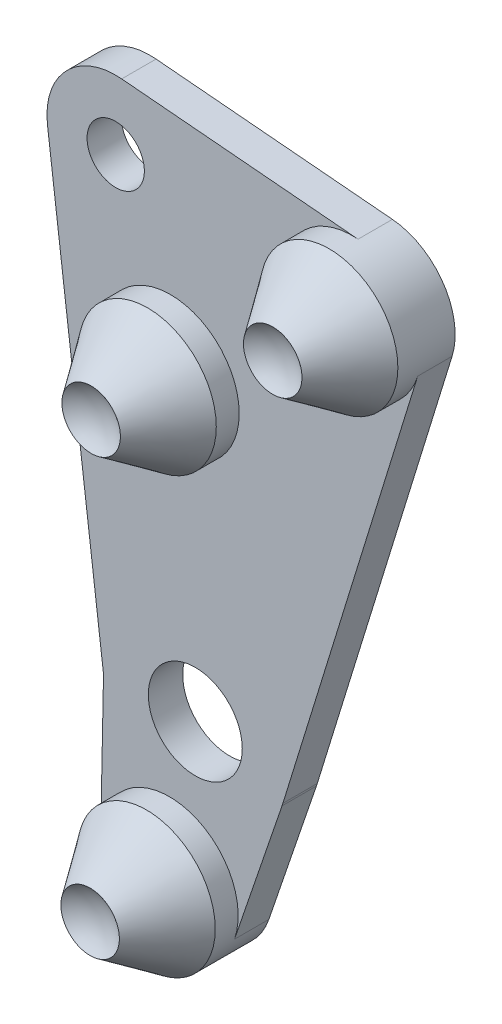
from build123d import *
from build123d.topology import SkipClean

# Parameters (mm, degrees)
BOSS_EXTRUDE1_DEPTH = 3
BOSS_EXTRUDE5_DEPTH = 3
BOSS_EXTRUDE2_DEPTH = 3
SKETCH3_R           = 4.1
CUT_EXTRUDE1_DEPTH  = 50
SKETCH1_4_R         = 6
BOSS_EXTRUDE3_DEPTH = 10
SKETCH2_4_R         = 6
BOSS_EXTRUDE4_DEPTH = 10
CHAMFER1_SIZE       = 5
CHAMFER1_SIZE_2     = 3.501037691
SKETCH9_R           = 2.5
CUT_EXTRUDE2_DEPTH  = 3


with BuildPart() as part:
    # Sketch1 → Boss-Extrude1 (new body)
    with BuildSketch(Plane.XY):
        with BuildLine():
            ThreePointArc((-7.862783113, 28.36246747), (-9.674812704, 26.016588816), (-10.142674299, 23.089524856))
            Line((-10.142674299, 23.089524856), (-7.966824047, -0.727814955))
            ThreePointArc((-7.966824047, -0.727814955), (-0.830270862, -7.956798998), (7.644946217, -2.356861757))
            Line((7.644946217, -2.356861757), (19.414515396, 35.820058514))
            ThreePointArc((19.414515396, 35.820058514), (17.084366379, 42.528936958), (9.985578884, 42.314786229))
            Line((9.985578884, 42.314786229), (-7.862783113, 28.36246747))
        make_face()
    extrude(amount=BOSS_EXTRUDE1_DEPTH)

    # Sketch8 → Boss-Extrude5 (add)
    with BuildSketch(Plane.XY):
        with BuildLine():
            Line((14.20374019, 43.56487302), (-6.42299265, 45.369478309))
            ThreePointArc((-6.42299265, 45.369478309), (-11.266837417, 43.555209842), (-12.899477398, 38.647166557))
            Line((-12.899477398, 38.647166557), (-7.938067055, -0.993524752))
            ThreePointArc((-7.938067055, -0.993524752), (-7.953555222, -0.86078995), (-7.966824047, -0.727814955))
            Line((-7.966824047, -0.727814955), (-10.142674299, 23.089524856))
            ThreePointArc((-10.142674299, 23.089524856), (-9.674812704, 26.016588816), (-7.862783113, 28.36246747))
            Line((-7.862783113, 28.36246747), (9.985578884, 42.314786229))
            ThreePointArc((9.985578884, 42.314786229), (11.97594826, 43.340396462), (14.20374019, 43.56487302))
        make_face()
    extrude(amount=BOSS_EXTRUDE5_DEPTH)

    # Sketch2 → Boss-Extrude2 (add)
    with BuildSketch(Plane.XY):
        with BuildLine():
            Line((-7.9983883, 0.16057583), (-8.256217535, -12.682068917))
            ThreePointArc((-8.256217535, -12.682068917), (-3.299315376, -18.711347307), (3.420783665, -14.741039282))
            Line((3.420783665, -14.741039282), (7.570946632, -2.584717991))
            ThreePointArc((7.570946632, -2.584717991), (-1.389185421, -7.878462024), (-7.9983883, 0.16057583))
        make_face()
    extrude(amount=BOSS_EXTRUDE2_DEPTH)

    # Sketch3 → Cut-Extrude1 (cut)
    with BuildSketch(Plane.XY.offset(3)):
        Circle(SKETCH3_R)
    extrude(amount=-CUT_EXTRUDE1_DEPTH, mode=Mode.SUBTRACT)

    # Sketch1<4> → Boss-Extrude3 (add)
    with BuildSketch(Plane.XY):
        with Locations(Location((13.680805733, 37.587704831, 0), (0, 0, 85))):
            Circle(SKETCH1_4_R)
        with Locations((-2.167556264, 25.198814555)):
            Circle(SKETCH1_4_R)
    extrude(amount=BOSS_EXTRUDE3_DEPTH)

    # Sketch2<4> → Boss-Extrude4 (add)
    with BuildSketch(Plane.XY):
        with Locations(Location((-2.25742631, -12.802500789, 0), (0, 0, 178.849883098))):
            Circle(SKETCH2_4_R)
    extrude(amount=BOSS_EXTRUDE4_DEPTH)

    # Sketch5 one side → Cut-Revolve1 (revolve, cut)
    with SkipClean():  # the faces are left unmerged after this step: merging them gives an invalid solid
        with BuildSketch(Plane(origin=(13.680805733, 0, 0), x_dir=(0, 0, -1), z_dir=(1, 0, 0))):
            with BuildLine():
                ThreePointArc((-13, 33.587704831), (-10.171572875, 34.759277707), (-9, 37.587704831))
                ThreePointArc((-9, 37.587704831), (-10.171572875, 40.416131956), (-13, 41.587704831))
                Line((-13, 41.587704831), (-13, 33.587704831))
            make_face()
        revolve(axis=Axis((13.680805733, 41.587704831, 13), (0, -1, 0)), mode=Mode.SUBTRACT)

    # Sketch6 → Cut-Revolve2 (revolve, cut)
    with SkipClean():  # the faces are left unmerged after this step: merging them gives an invalid solid
        with BuildSketch(Plane(origin=(-2.167556264, 0, 0), x_dir=(0, 0, -1), z_dir=(1, 0, 0))):
            with BuildLine():
                ThreePointArc((-9, 25.198814555), (-10.171572875, 28.02724168), (-13, 29.198814555))
                Line((-13, 29.198814555), (-13, 21.198814555))
                ThreePointArc((-13, 21.198814555), (-10.171572875, 22.37038743), (-9, 25.198814555))
            make_face()
            with BuildLine():
                Line((-13, 21.198814555), (-13, 29.198814555))
                ThreePointArc((-13, 29.198814555), (-17, 25.198814555), (-13, 21.198814555))
            make_face()
        revolve(axis=Axis((-2.167556264, 29.198814555, 13), (0, -1, 0)), mode=Mode.SUBTRACT)

    # Sketch7 → Cut-Revolve3 (revolve, cut)
    with SkipClean():  # the faces are left unmerged after this step: merging them gives an invalid solid
        with BuildSketch(Plane(origin=(-2.25742631, 0, 0), x_dir=(0, 0, -1), z_dir=(1, 0, 0))):
            with BuildLine():
                ThreePointArc((-9, -12.802500789), (-10.171572875, -9.974073664), (-13, -8.802500789))
                Line((-13, -8.802500789), (-13, -16.802500789))
                ThreePointArc((-13, -16.802500789), (-10.171572875, -15.630927914), (-9, -12.802500789))
            make_face()
            with BuildLine():
                Line((-13, -16.802500789), (-13, -8.802500789))
                ThreePointArc((-13, -8.802500789), (-17, -12.802500789), (-13, -16.802500789))
            make_face()
        revolve(axis=Axis((-2.25742631, -8.802500789, 13), (0, -1, 0)), mode=Mode.SUBTRACT)

    # Chamfer1
    # the kernel refuses this chamfer: 5, 3.501037691 mm, written as the material it takes off along each edge
    with BuildSketch(Plane(origin=(-2.25742631, -12.802500789, 10), x_dir=(-0.9997985375420249, 0.020071978697384193, 0), z_dir=(0.020071978697384193, 0.9997985375420249, 0))) as chamfer1_piece_1:
        Polygon((6, -CHAMFER1_SIZE), (6 - CHAMFER1_SIZE_2, 0), (6, 0), align=None)
    revolve(axis=Axis((-2.25742631, -12.802500789, 10), (0, 0, 1)), mode=Mode.SUBTRACT)
    with BuildSketch(Plane(origin=(13.680805733, 37.587704831, 10), x_dir=(0.08715574274765815, 0.9961946980917454, 0), z_dir=(0.9961946980917454, -0.08715574274765815, 0))) as chamfer1_piece_2:
        Polygon((6, -CHAMFER1_SIZE), (6 - CHAMFER1_SIZE_2, 0), (6, 0), align=None)
    revolve(axis=Axis((13.680805733, 37.587704831, 10), (0, 0, 1)), mode=Mode.SUBTRACT)
    with BuildSketch(Plane(origin=(-2.167556264, 25.198814555, 10), x_dir=(1, 0, 0), z_dir=(0, -1, 0))) as chamfer1_piece_3:
        Polygon((6, -CHAMFER1_SIZE), (6 - CHAMFER1_SIZE_2, 0), (6, 0), align=None)
    revolve(axis=Axis((-2.167556264, 25.198814555, 10), (0, 0, 1)), mode=Mode.SUBTRACT)

    # Sketch9 → Cut-Extrude2 (cut)
    with BuildSketch(Plane(origin=(0, 0, 0), x_dir=(-1, 0, 0), z_dir=(0, 0, -1))):
        with Locations((6.945927107, 39.39231012)):
            Circle(SKETCH9_R)
    extrude(amount=-CUT_EXTRUDE2_DEPTH, mode=Mode.SUBTRACT)


solid = part.part
